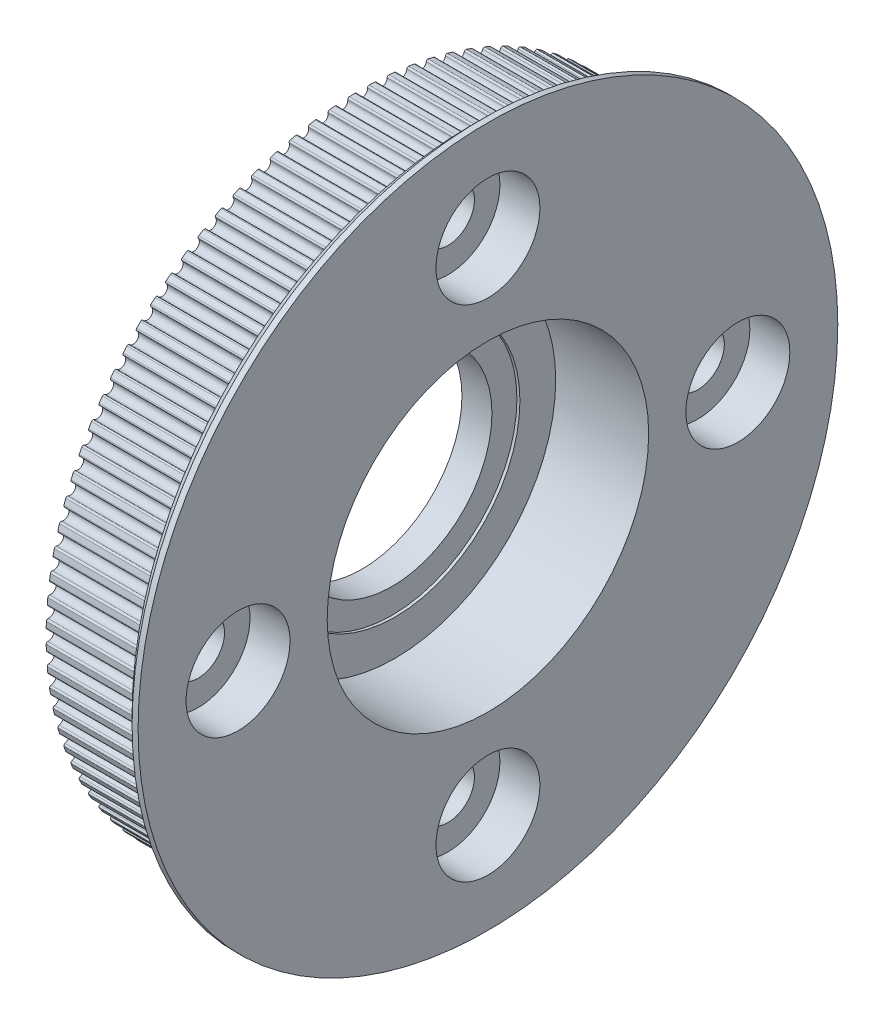
from build123d import *

# Parameters (mm, degrees)
SKETCH1_R               = 31.6
SKETCH1_R_2             = 7.65
BOSS_EXTRUDE1_DEPTH     = 11
SKETCH2_R               = 0.55
CUT_EXTRUDE1_DEPTH      = 11
FILLET1_R               = 0.16
SKETCH3_R               = 35
SKETCH3_R_2             = 7.65
BOSS_EXTRUDE2_DEPTH     = 1.6
SKETCH6_R               = 2.2
CUT_EXTRUDE6_DEPTH      = 12.6
SKETCH7_R               = 3.7
CUT_EXTRUDE4_DEPTH      = 4
CHAMFER1_SIZE           = 1
SKETCH8_R               = 15.15
CUT_EXTRUDE7_DEPTH      = 3.3
CROQUIS2_R              = 16.08
CORTAR_EXTRUIR2_DEPTH   = 9.3
CROQUIS6_R              = 12.5
SALIENTE_EXTRUIR1_DEPTH = 13
CORTAR_EXTRUIR3_START   = -10
CROQUIS7_R              = 12.5
CORTAR_EXTRUIR3_DEPTH   = 10
CROQUIS8_R              = 10
CORTAR_EXTRUIR4_DEPTH   = 51.419837366
CROQUIS9_R              = 5.2
CORTAR_EXTRUIR5_DEPTH   = 4
CROQUIS10_R             = 2.65
CORTAR_EXTRUIR6_DEPTH   = 51.23902867
CROQUIS11_R             = 2.65
CORTAR_EXTRUIR7_DEPTH   = 51.23902867
CROQUIS12_R             = 2.65
CORTAR_EXTRUIR8_DEPTH   = 51.23902867
CROQUIS13_R             = 2.65
CORTAR_EXTRUIR9_DEPTH   = 51.23902867


with BuildPart() as part:
    # Sketch1 → Boss-Extrude1 (new body)
    with BuildSketch(Plane(origin=(0, 0, 0), x_dir=(0, 0, -1), z_dir=(1, 0, 0))):
        Circle(SKETCH1_R)
        Circle(SKETCH1_R_2, mode=Mode.SUBTRACT)
    extrude(amount=BOSS_EXTRUDE1_DEPTH)

    # Sketch2 → Cut-Extrude1 (cut)
    with BuildSketch(Plane(origin=(0, 0, 0), x_dir=(0, 0, -1), z_dir=(1, 0, 0))):
        with Locations((0, 31.39)):
            Circle(SKETCH2_R)
        with Locations((1.970994408, 31.328059005)):
            Circle(SKETCH2_R)
        with Locations((3.934210202, 31.142480474)):
            Circle(SKETCH2_R)
        with Locations((5.881899465, 30.8339968)):
            Circle(SKETCH2_R)
        with Locations((7.806375558, 30.403825428)):
            Circle(SKETCH2_R)
        with Locations((9.700043453, 29.853664047)):
            Circle(SKETCH2_R)
        with Locations((11.555429709, 29.185683892)):
            Circle(SKETCH2_R)
        with Locations((13.365211962, 28.402521177)):
            Circle(SKETCH2_R)
        with Locations((15.12224783, 27.507266687)):
            Circle(SKETCH2_R)
        with Locations((16.819603094, 26.503453582)):
            Circle(SKETCH2_R)
        with Locations((18.450579069, 25.395043453)):
            Circle(SKETCH2_R)
        with Locations((20.008739038, 24.186410691)):
            Circle(SKETCH2_R)
        with Locations((21.487933655, 22.882325215)):
            Circle(SKETCH2_R)
        with Locations((22.882325215, 21.487933655)):
            Circle(SKETCH2_R)
        with Locations((24.186410691, 20.008739038)):
            Circle(SKETCH2_R)
        with Locations((25.395043453, 18.450579069)):
            Circle(SKETCH2_R)
        with Locations((26.503453582, 16.819603094)):
            Circle(SKETCH2_R)
        with Locations((27.507266687, 15.12224783)):
            Circle(SKETCH2_R)
        with Locations((28.402521177, 13.365211962)):
            Circle(SKETCH2_R)
        with Locations((29.185683892, 11.555429709)):
            Circle(SKETCH2_R)
        with Locations((29.853664047, 9.700043453)):
            Circle(SKETCH2_R)
        with Locations((30.403825428, 7.806375558)):
            Circle(SKETCH2_R)
        with Locations((30.8339968, 5.881899465)):
            Circle(SKETCH2_R)
        with Locations((31.142480474, 3.934210202)):
            Circle(SKETCH2_R)
        with Locations((31.328059005, 1.970994408)):
            Circle(SKETCH2_R)
        with Locations((31.39, 0)):
            Circle(SKETCH2_R)
        with Locations((31.328059005, -1.970994408)):
            Circle(SKETCH2_R)
        with Locations((31.142480474, -3.934210202)):
            Circle(SKETCH2_R)
        with Locations((30.8339968, -5.881899465)):
            Circle(SKETCH2_R)
        with Locations((30.403825428, -7.806375558)):
            Circle(SKETCH2_R)
        with Locations((29.853664047, -9.700043453)):
            Circle(SKETCH2_R)
        with Locations((29.185683892, -11.555429709)):
            Circle(SKETCH2_R)
        with Locations((28.402521177, -13.365211962)):
            Circle(SKETCH2_R)
        with Locations((27.507266687, -15.12224783)):
            Circle(SKETCH2_R)
        with Locations((26.503453582, -16.819603094)):
            Circle(SKETCH2_R)
        with Locations((25.395043453, -18.450579069)):
            Circle(SKETCH2_R)
        with Locations((24.186410691, -20.008739038)):
            Circle(SKETCH2_R)
        with Locations((22.882325215, -21.487933655)):
            Circle(SKETCH2_R)
        with Locations((21.487933655, -22.882325215)):
            Circle(SKETCH2_R)
        with Locations((20.008739038, -24.186410691)):
            Circle(SKETCH2_R)
        with Locations((18.450579069, -25.395043453)):
            Circle(SKETCH2_R)
        with Locations((16.819603094, -26.503453582)):
            Circle(SKETCH2_R)
        with Locations((15.12224783, -27.507266687)):
            Circle(SKETCH2_R)
        with Locations((13.365211962, -28.402521177)):
            Circle(SKETCH2_R)
        with Locations((11.555429709, -29.185683892)):
            Circle(SKETCH2_R)
        with Locations((9.700043453, -29.853664047)):
            Circle(SKETCH2_R)
        with Locations((7.806375558, -30.403825428)):
            Circle(SKETCH2_R)
        with Locations((5.881899465, -30.8339968)):
            Circle(SKETCH2_R)
        with Locations((3.934210202, -31.142480474)):
            Circle(SKETCH2_R)
        with Locations((1.970994408, -31.328059005)):
            Circle(SKETCH2_R)
        with Locations((0, -31.39)):
            Circle(SKETCH2_R)
        with Locations((-1.970994408, -31.328059005)):
            Circle(SKETCH2_R)
        with Locations((-3.934210202, -31.142480474)):
            Circle(SKETCH2_R)
        with Locations((-5.881899465, -30.8339968)):
            Circle(SKETCH2_R)
        with Locations((-7.806375558, -30.403825428)):
            Circle(SKETCH2_R)
        with Locations((-9.700043453, -29.853664047)):
            Circle(SKETCH2_R)
        with Locations((-11.555429709, -29.185683892)):
            Circle(SKETCH2_R)
        with Locations((-13.365211962, -28.402521177)):
            Circle(SKETCH2_R)
        with Locations((-15.12224783, -27.507266687)):
            Circle(SKETCH2_R)
        with Locations((-16.819603094, -26.503453582)):
            Circle(SKETCH2_R)
        with Locations((-18.450579069, -25.395043453)):
            Circle(SKETCH2_R)
        with Locations((-20.008739038, -24.186410691)):
            Circle(SKETCH2_R)
        with Locations((-21.487933655, -22.882325215)):
            Circle(SKETCH2_R)
        with Locations((-22.882325215, -21.487933655)):
            Circle(SKETCH2_R)
        with Locations((-24.186410691, -20.008739038)):
            Circle(SKETCH2_R)
        with Locations((-25.395043453, -18.450579069)):
            Circle(SKETCH2_R)
        with Locations((-26.503453582, -16.819603094)):
            Circle(SKETCH2_R)
        with Locations((-27.507266687, -15.12224783)):
            Circle(SKETCH2_R)
        with Locations((-28.402521177, -13.365211962)):
            Circle(SKETCH2_R)
        with Locations((-29.185683892, -11.555429709)):
            Circle(SKETCH2_R)
        with Locations((-29.853664047, -9.700043453)):
            Circle(SKETCH2_R)
        with Locations((-30.403825428, -7.806375558)):
            Circle(SKETCH2_R)
        with Locations((-30.8339968, -5.881899465)):
            Circle(SKETCH2_R)
        with Locations((-31.142480474, -3.934210202)):
            Circle(SKETCH2_R)
        with Locations((-31.328059005, -1.970994408)):
            Circle(SKETCH2_R)
        with Locations((-31.39, 0)):
            Circle(SKETCH2_R)
        with Locations((-31.328059005, 1.970994408)):
            Circle(SKETCH2_R)
        with Locations((-31.142480474, 3.934210202)):
            Circle(SKETCH2_R)
        with Locations((-30.8339968, 5.881899465)):
            Circle(SKETCH2_R)
        with Locations((-30.403825428, 7.806375558)):
            Circle(SKETCH2_R)
        with Locations((-29.853664047, 9.700043453)):
            Circle(SKETCH2_R)
        with Locations((-29.185683892, 11.555429709)):
            Circle(SKETCH2_R)
        with Locations((-28.402521177, 13.365211962)):
            Circle(SKETCH2_R)
        with Locations((-27.507266687, 15.12224783)):
            Circle(SKETCH2_R)
        with Locations((-26.503453582, 16.819603094)):
            Circle(SKETCH2_R)
        with Locations((-25.395043453, 18.450579069)):
            Circle(SKETCH2_R)
        with Locations((-24.186410691, 20.008739038)):
            Circle(SKETCH2_R)
        with Locations((-22.882325215, 21.487933655)):
            Circle(SKETCH2_R)
        with Locations((-21.487933655, 22.882325215)):
            Circle(SKETCH2_R)
        with Locations((-20.008739038, 24.186410691)):
            Circle(SKETCH2_R)
        with Locations((-18.450579069, 25.395043453)):
            Circle(SKETCH2_R)
        with Locations((-16.819603094, 26.503453582)):
            Circle(SKETCH2_R)
        with Locations((-15.12224783, 27.507266687)):
            Circle(SKETCH2_R)
        with Locations((-13.365211962, 28.402521177)):
            Circle(SKETCH2_R)
        with Locations((-11.555429709, 29.185683892)):
            Circle(SKETCH2_R)
        with Locations((-9.700043453, 29.853664047)):
            Circle(SKETCH2_R)
        with Locations((-7.806375558, 30.403825428)):
            Circle(SKETCH2_R)
        with Locations((-5.881899465, 30.8339968)):
            Circle(SKETCH2_R)
        with Locations((-3.934210202, 31.142480474)):
            Circle(SKETCH2_R)
        with Locations((-1.970994408, 31.328059005)):
            Circle(SKETCH2_R)
    extrude(amount=CUT_EXTRUDE1_DEPTH, mode=Mode.SUBTRACT)

    # Fillet1
    fillet1_edges = [part.edges().sort_by_distance(p)[0] for p in [
        (5.5, 31.59588404, 0.510011532),
        (5.5, 31.59588404, -0.510011532),
        (5.5, 31.501512891, 2.492927114),
        (5.5, 31.565560669, 1.474916834),
        (5.5, 31.282819662, 4.466004252),
        (5.5, 31.410662451, 3.454024376),
        (5.5, 30.940667436, 6.421456112),
        (5.5, 31.131800699, 5.419500462),
        (5.5, 30.476406531, 8.351565418),
        (5.5, 30.730075952, 7.363588255),
        (5.5, 29.891869173, 10.248714911),
        (5.5, 30.207073634, 9.27861533),
        (5.5, 29.189362264, 12.105417408),
        (5.5, 29.564857798, 11.157023949),
        (5.5, 28.371658277, 13.914345353),
        (5.5, 28.805962974, 12.991400892),
        (5.5, 27.441984317, 15.668359734),
        (5.5, 27.933384175, 14.774506711),
        (5.5, 26.404009381, 17.360538258),
        (5.5, 26.95056507, 16.499304301),
        (5.5, 25.261829884, 18.984202668),
        (5.5, 25.861384397, 18.158986675),
        (5.5, 24.019953484, 20.532945103),
        (5.5, 24.670140655, 19.747003825),
        (5.5, 22.683281303, 22.000653385),
        (5.5, 23.381535138, 21.257088572),
        (5.5, 21.257088572, 23.381535138),
        (5.5, 22.000653385, 22.683281303),
        (5.5, 19.747003825, 24.670140655),
        (5.5, 20.532945103, 24.019953484),
        (5.5, 18.158986675, 25.861384397),
        (5.5, 18.984202668, 25.261829884),
        (5.5, 16.499304301, 26.95056507),
        (5.5, 17.360538258, 26.404009381),
        (5.5, 14.774506711, 27.933384175),
        (5.5, 15.668359734, 27.441984317),
        (5.5, 12.991400892, 28.805962974),
        (5.5, 13.914345353, 28.371658277),
        (5.5, 11.157023949, 29.564857798),
        (5.5, 12.105417408, 29.189362264),
        (5.5, 9.27861533, 30.207073634),
        (5.5, 10.248714911, 29.891869173),
        (5.5, 7.363588255, 30.730075952),
        (5.5, 8.351565418, 30.476406531),
        (5.5, 5.419500462, 31.131800699),
        (5.5, 6.421456112, 30.940667436),
        (5.5, 3.454024376, 31.410662451),
        (5.5, 4.466004252, 31.282819662),
        (5.5, 1.474916834, 31.565560669),
        (5.5, 2.492927114, 31.501512891),
        (5.5, -0.510011532, 31.59588404),
        (5.5, 0.510011532, 31.59588404),
        (5.5, -2.492927114, 31.501512891),
        (5.5, -1.474916834, 31.565560669),
        (5.5, -4.466004252, 31.282819662),
        (5.5, -3.454024376, 31.410662451),
        (5.5, -6.421456112, 30.940667436),
        (5.5, -5.419500462, 31.131800699),
        (5.5, -8.351565418, 30.476406531),
        (5.5, -7.363588255, 30.730075952),
        (5.5, -10.248714911, 29.891869173),
        (5.5, -9.27861533, 30.207073634),
        (5.5, -12.105417408, 29.189362264),
        (5.5, -11.157023949, 29.564857798),
        (5.5, -13.914345353, 28.371658277),
        (5.5, -12.991400892, 28.805962974),
        (5.5, -15.668359734, 27.441984317),
        (5.5, -14.774506711, 27.933384175),
        (5.5, -17.360538258, 26.404009381),
        (5.5, -16.499304301, 26.95056507),
        (5.5, -18.984202668, 25.261829884),
        (5.5, -18.158986675, 25.861384397),
        (5.5, -20.532945103, 24.019953484),
        (5.5, -19.747003825, 24.670140655),
        (5.5, -22.000653385, 22.683281303),
        (5.5, -21.257088572, 23.381535138),
        (5.5, -23.381535138, 21.257088572),
        (5.5, -22.683281303, 22.000653385),
        (5.5, -24.670140655, 19.747003825),
        (5.5, -24.019953484, 20.532945103),
        (5.5, -25.861384397, 18.158986675),
        (5.5, -25.261829884, 18.984202668),
        (5.5, -26.95056507, 16.499304301),
        (5.5, -26.404009381, 17.360538258),
        (5.5, -27.933384175, 14.774506711),
        (5.5, -27.441984317, 15.668359734),
        (5.5, -28.805962974, 12.991400892),
        (5.5, -28.371658277, 13.914345353),
        (5.5, -29.564857798, 11.157023949),
        (5.5, -29.189362264, 12.105417408),
        (5.5, -30.207073634, 9.27861533),
        (5.5, -29.891869173, 10.248714911),
        (5.5, -30.730075952, 7.363588255),
        (5.5, -30.476406531, 8.351565418),
        (5.5, -31.131800699, 5.419500462),
        (5.5, -30.940667436, 6.421456112),
        (5.5, -31.410662451, 3.454024376),
        (5.5, -31.282819662, 4.466004252),
        (5.5, -31.565560669, 1.474916834),
        (5.5, -31.501512891, 2.492927114),
        (5.5, -31.59588404, -0.510011532),
        (5.5, -31.59588404, 0.510011532),
        (5.5, -31.501512891, -2.492927114),
        (5.5, -31.565560669, -1.474916834),
        (5.5, -31.282819662, -4.466004252),
        (5.5, -31.410662451, -3.454024376),
        (5.5, -30.940667436, -6.421456112),
        (5.5, -31.131800699, -5.419500462),
        (5.5, -30.476406531, -8.351565418),
        (5.5, -30.730075952, -7.363588255),
        (5.5, -29.891869173, -10.248714911),
        (5.5, -30.207073634, -9.27861533),
        (5.5, -29.189362264, -12.105417408),
        (5.5, -29.564857798, -11.157023949),
        (5.5, -28.371658277, -13.914345353),
        (5.5, -28.805962974, -12.991400892),
        (5.5, -27.441984317, -15.668359734),
        (5.5, -27.933384175, -14.774506711),
        (5.5, -26.404009381, -17.360538258),
        (5.5, -26.95056507, -16.499304301),
        (5.5, -25.261829884, -18.984202668),
        (5.5, -25.861384397, -18.158986675),
        (5.5, -24.019953484, -20.532945103),
        (5.5, -24.670140655, -19.747003825),
        (5.5, -22.683281303, -22.000653385),
        (5.5, -23.381535138, -21.257088572),
        (5.5, -21.257088572, -23.381535138),
        (5.5, -22.000653385, -22.683281303),
        (5.5, -19.747003825, -24.670140655),
        (5.5, -20.532945103, -24.019953484),
        (5.5, -18.158986675, -25.861384397),
        (5.5, -18.984202668, -25.261829884),
        (5.5, -16.499304301, -26.95056507),
        (5.5, -17.360538258, -26.404009381),
        (5.5, -14.774506711, -27.933384175),
        (5.5, -15.668359734, -27.441984317),
        (5.5, -12.991400892, -28.805962974),
        (5.5, -13.914345353, -28.371658277),
        (5.5, -11.157023949, -29.564857798),
        (5.5, -12.105417408, -29.189362264),
        (5.5, -9.27861533, -30.207073634),
        (5.5, -10.248714911, -29.891869173),
        (5.5, -7.363588255, -30.730075952),
        (5.5, -8.351565418, -30.476406531),
        (5.5, -5.419500462, -31.131800699),
        (5.5, -6.421456112, -30.940667436),
        (5.5, -3.454024376, -31.410662451),
        (5.5, -4.466004252, -31.282819662),
        (5.5, -1.474916834, -31.565560669),
        (5.5, -2.492927114, -31.501512891),
        (5.5, 0.510011532, -31.59588404),
        (5.5, -0.510011532, -31.59588404),
        (5.5, 2.492927114, -31.501512891),
        (5.5, 1.474916834, -31.565560669),
        (5.5, 4.466004252, -31.282819662),
        (5.5, 3.454024376, -31.410662451),
        (5.5, 6.421456112, -30.940667436),
        (5.5, 5.419500462, -31.131800699),
        (5.5, 8.351565418, -30.476406531),
        (5.5, 7.363588255, -30.730075952),
        (5.5, 10.248714911, -29.891869173),
        (5.5, 9.27861533, -30.207073634),
        (5.5, 12.105417408, -29.189362264),
        (5.5, 11.157023949, -29.564857798),
        (5.5, 13.914345353, -28.371658277),
        (5.5, 12.991400892, -28.805962974),
        (5.5, 15.668359734, -27.441984317),
        (5.5, 14.774506711, -27.933384175),
        (5.5, 17.360538258, -26.404009381),
        (5.5, 16.499304301, -26.95056507),
        (5.5, 18.984202668, -25.261829884),
        (5.5, 18.158986675, -25.861384397),
        (5.5, 20.532945103, -24.019953484),
        (5.5, 19.747003825, -24.670140655),
        (5.5, 22.000653385, -22.683281303),
        (5.5, 21.257088572, -23.381535138),
        (5.5, 23.381535138, -21.257088572),
        (5.5, 22.683281303, -22.000653385),
        (5.5, 24.670140655, -19.747003825),
        (5.5, 24.019953484, -20.532945103),
        (5.5, 25.861384397, -18.158986675),
        (5.5, 25.261829884, -18.984202668),
        (5.5, 26.95056507, -16.499304301),
        (5.5, 26.404009381, -17.360538258),
        (5.5, 27.933384175, -14.774506711),
        (5.5, 27.441984317, -15.668359734),
        (5.5, 28.805962974, -12.991400892),
        (5.5, 28.371658277, -13.914345353),
        (5.5, 29.564857798, -11.157023949),
        (5.5, 29.189362264, -12.105417408),
        (5.5, 30.207073634, -9.27861533),
        (5.5, 29.891869173, -10.248714911),
        (5.5, 30.730075952, -7.363588255),
        (5.5, 30.476406531, -8.351565418),
        (5.5, 31.131800699, -5.419500462),
        (5.5, 30.940667436, -6.421456112),
        (5.5, 31.410662451, -3.454024376),
        (5.5, 31.282819662, -4.466004252),
        (5.5, 31.565560669, -1.474916834),
        (5.5, 31.501512891, -2.492927114),
    ]]
    fillet(fillet1_edges, radius=FILLET1_R)

    # Sketch3 → Boss-Extrude2 (add)
    with BuildSketch(Plane(origin=(11, 0, 0), x_dir=(0, 0, -1), z_dir=(1, 0, 0))):
        Circle(SKETCH3_R)
        Circle(SKETCH3_R_2, mode=Mode.SUBTRACT)
    extrude(amount=BOSS_EXTRUDE2_DEPTH)

    # Sketch6 → Cut-Extrude6 (cut)
    with BuildSketch(Plane(origin=(12.6, 0, 0), x_dir=(0, 0, -1), z_dir=(1, 0, 0))):
        with Locations((0, -25)):
            Circle(SKETCH6_R)
        with Locations((-25, 0)):
            Circle(SKETCH6_R)
        with Locations((0, 25)):
            Circle(SKETCH6_R)
        with Locations((25, 0)):
            Circle(SKETCH6_R)
    extrude(amount=-CUT_EXTRUDE6_DEPTH, mode=Mode.SUBTRACT)

    # Sketch7 → Cut-Extrude4 (cut)
    with BuildSketch(Plane(origin=(12.6, 0, 0), x_dir=(0, 0, -1), z_dir=(1, 0, 0))):
        with Locations((0, -25)):
            Circle(SKETCH7_R)
        with Locations((-25, 0)):
            Circle(SKETCH7_R)
        with Locations((0, 25)):
            Circle(SKETCH7_R)
        with Locations((25, 0)):
            Circle(SKETCH7_R)
    extrude(amount=-CUT_EXTRUDE4_DEPTH, mode=Mode.SUBTRACT)

    # Chamfer1
    chamfer1_edges = [part.edges().sort_by_distance(p)[0] for p in [
        (11, 0, 35),
    ]]
    chamfer(chamfer1_edges, length=CHAMFER1_SIZE)

    # Sketch8 → Cut-Extrude7 (cut)
    with BuildSketch(Plane(origin=(12.6, 0, 0), x_dir=(0, 0, -1), z_dir=(1, 0, 0))):
        Circle(SKETCH8_R)
    extrude(amount=-CUT_EXTRUDE7_DEPTH, mode=Mode.SUBTRACT)

    # Croquis2 → Cortar-Extruir2 (cut)
    with BuildSketch(Plane(origin=(12.6, 0, 0), x_dir=(0, 0, -1), z_dir=(1, 0, 0))):
        Circle(CROQUIS2_R)
    extrude(amount=-CORTAR_EXTRUIR2_DEPTH, mode=Mode.SUBTRACT)

    # Croquis6 → Saliente-Extruir1 (add)
    with BuildSketch(Plane.ZY):
        Circle(CROQUIS6_R)
    extrude(amount=-SALIENTE_EXTRUIR1_DEPTH)

    # Croquis7 → Cortar-Extruir3 (cut)
    with BuildSketch(Plane(origin=(13, 0, 0), x_dir=(0, 0, -1), z_dir=(1, 0, 0)).offset(CORTAR_EXTRUIR3_START)):
        Circle(CROQUIS7_R)
    extrude(amount=CORTAR_EXTRUIR3_DEPTH, mode=Mode.SUBTRACT)

    # Croquis8 → Cortar-Extruir4 (cut, through all)
    with BuildSketch(Plane(origin=(3, 0, 0), x_dir=(0, 0, -1), z_dir=(1, 0, 0))):
        Circle(CROQUIS8_R)
    extrude(amount=-CORTAR_EXTRUIR4_DEPTH, mode=Mode.SUBTRACT)

    # Croquis9 → Cortar-Extruir5 (cut)
    with BuildSketch(Plane(origin=(12.6, 0, 0), x_dir=(0, 0, -1), z_dir=(1, 0, 0))):
        with Locations((25, 0)):
            Circle(CROQUIS9_R)
        with Locations((0, -25)):
            Circle(CROQUIS9_R)
        with Locations((-25, 0)):
            Circle(CROQUIS9_R)
        with Locations((0, 25)):
            Circle(CROQUIS9_R)
    extrude(amount=-CORTAR_EXTRUIR5_DEPTH, mode=Mode.SUBTRACT)

    # Croquis10 → Cortar-Extruir6 (cut, through all)
    with BuildSketch(Plane(origin=(8.6, 0, 0), x_dir=(0, 0, -1), z_dir=(1, 0, 0))):
        with Locations((0, -25)):
            Circle(CROQUIS10_R)
    extrude(amount=-CORTAR_EXTRUIR6_DEPTH, mode=Mode.SUBTRACT)

    # Croquis11 → Cortar-Extruir7 (cut, through all)
    with BuildSketch(Plane(origin=(8.6, 0, 0), x_dir=(0, 0, -1), z_dir=(1, 0, 0))):
        with Locations((-25, 0)):
            Circle(CROQUIS11_R)
    extrude(amount=-CORTAR_EXTRUIR7_DEPTH, mode=Mode.SUBTRACT)

    # Croquis12 → Cortar-Extruir8 (cut, through all)
    with BuildSketch(Plane(origin=(8.6, 0, 0), x_dir=(0, 0, -1), z_dir=(1, 0, 0))):
        with Locations((0, 25)):
            Circle(CROQUIS12_R)
    extrude(amount=-CORTAR_EXTRUIR8_DEPTH, mode=Mode.SUBTRACT)

    # Croquis13 → Cortar-Extruir9 (cut, through all)
    with BuildSketch(Plane(origin=(8.6, 0, 0), x_dir=(0, 0, -1), z_dir=(1, 0, 0))):
        with Locations((25, 0)):
            Circle(CROQUIS13_R)
    extrude(amount=-CORTAR_EXTRUIR9_DEPTH, mode=Mode.SUBTRACT)


solid = part.part
